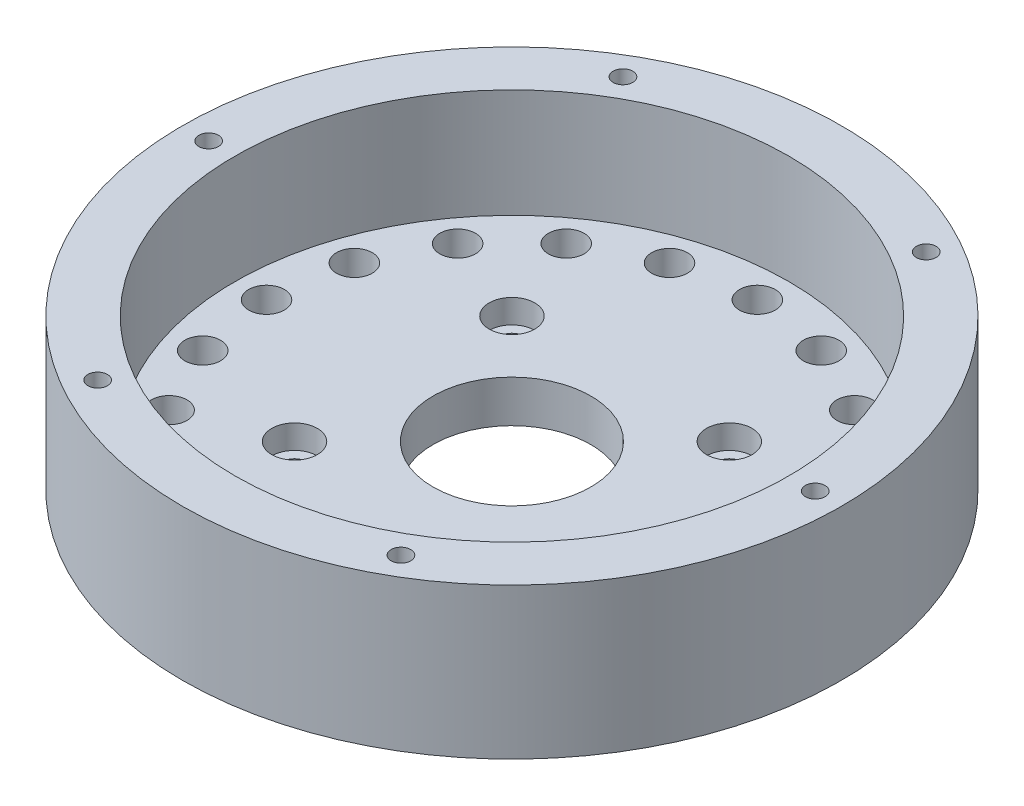
from build123d import *

# Parameters (mm, degrees)
SKETCH1_R                     = 47
BASE_BODY_DEPTH               = 21.5
SKETCH3_R                     = 39.5
CAVITY_DEPTH                  = 15.5
SKETCH4_R                     = 11.25
MOTOR_HOLE_DEPTH              = 69.251373613
MOTOR_SCREW_HOLES_D           = 3.6
MOTOR_SCREW_HOLES_CBORE_D     = 6.5
MOTOR_SCREW_HOLES_CBORE_DEPTH = 3.4
SKETCH8_R                     = 2.55
RING_PIN_HOLES_DEPTH          = 5
SKETCH9_R                     = 1.4
CAP_SCREW_HOLES_DEPTH         = 10


with BuildPart() as part:
    # Sketch1 → Base body (new body)
    with BuildSketch(Plane(origin=(0, 0, 0), x_dir=(1, 0, 0), z_dir=(0, 1, 0))):
        Circle(SKETCH1_R)
    extrude(amount=BASE_BODY_DEPTH)

    # Sketch3 → Cavity (cut)
    with BuildSketch(Plane(origin=(0, 21.5, 0), x_dir=(1, 0, 0), z_dir=(0, 1, 0))):
        Circle(SKETCH3_R)
    extrude(amount=-CAVITY_DEPTH, mode=Mode.SUBTRACT)

    # Sketch4 → Motor hole (cut, through all)
    with BuildSketch(Plane(origin=(0, 6, 0), x_dir=(1, 0, 0), z_dir=(0, 1, 0))):
        Circle(SKETCH4_R)
    extrude(amount=-MOTOR_HOLE_DEPTH, mode=Mode.SUBTRACT)

    # Motor screw holes (through all)
    with Locations(Plane(origin=(0, 6, 0), x_dir=(1, 0, 0), z_dir=(0, 1, 0))):
        with Locations((0, 0), (-15.5, -15.5), (15.5, 15.5), (15.5, -15.5), (-15.5, 15.5)):
            CounterBoreHole(MOTOR_SCREW_HOLES_D / 2, MOTOR_SCREW_HOLES_CBORE_D / 2, MOTOR_SCREW_HOLES_CBORE_DEPTH)

    # Sketch8 → Ring pin holes (cut)
    with BuildSketch(Plane(origin=(0, 6, 0), x_dir=(1, 0, 0), z_dir=(0, 1, 0))):
        with Locations((-35, 0)):
            Circle(SKETCH8_R)
        with Locations((-33.28697807, 10.815594803)):
            Circle(SKETCH8_R)
        with Locations((-28.315594803, 20.57248383)):
            Circle(SKETCH8_R)
        with Locations((-20.57248383, 28.315594803)):
            Circle(SKETCH8_R)
        with Locations((-10.815594803, 33.28697807)):
            Circle(SKETCH8_R)
        with Locations((0, 35)):
            Circle(SKETCH8_R)
        with Locations((10.815594803, 33.28697807)):
            Circle(SKETCH8_R)
        with Locations((20.57248383, 28.315594803)):
            Circle(SKETCH8_R)
        with Locations((28.315594803, 20.57248383)):
            Circle(SKETCH8_R)
        with Locations((33.28697807, 10.815594803)):
            Circle(SKETCH8_R)
        with Locations((35, 0)):
            Circle(SKETCH8_R)
        with Locations((33.28697807, -10.815594803)):
            Circle(SKETCH8_R)
        with Locations((28.315594803, -20.57248383)):
            Circle(SKETCH8_R)
        with Locations((20.57248383, -28.315594803)):
            Circle(SKETCH8_R)
        with Locations((10.815594803, -33.28697807)):
            Circle(SKETCH8_R)
        with Locations((0, -35)):
            Circle(SKETCH8_R)
        with Locations((-10.815594803, -33.28697807)):
            Circle(SKETCH8_R)
        with Locations((-20.57248383, -28.315594803)):
            Circle(SKETCH8_R)
        with Locations((-28.315594803, -20.57248383)):
            Circle(SKETCH8_R)
        with Locations((-33.28697807, -10.815594803)):
            Circle(SKETCH8_R)
    extrude(amount=-RING_PIN_HOLES_DEPTH, mode=Mode.SUBTRACT)

    # Sketch9 → Cap screw holes (cut)
    with BuildSketch(Plane(origin=(0, 21.5, 0), x_dir=(1, 0, 0), z_dir=(0, 1, 0))):
        with Locations((-43.25, 0)):
            Circle(SKETCH9_R)
        with Locations((-21.625, 37.455598714)):
            Circle(SKETCH9_R)
        with Locations((21.625, 37.455598714)):
            Circle(SKETCH9_R)
        with Locations((43.25, 0)):
            Circle(SKETCH9_R)
        with Locations((21.625, -37.455598714)):
            Circle(SKETCH9_R)
        with Locations((-21.625, -37.455598714)):
            Circle(SKETCH9_R)
    extrude(amount=-CAP_SCREW_HOLES_DEPTH, mode=Mode.SUBTRACT)


solid = part.part
